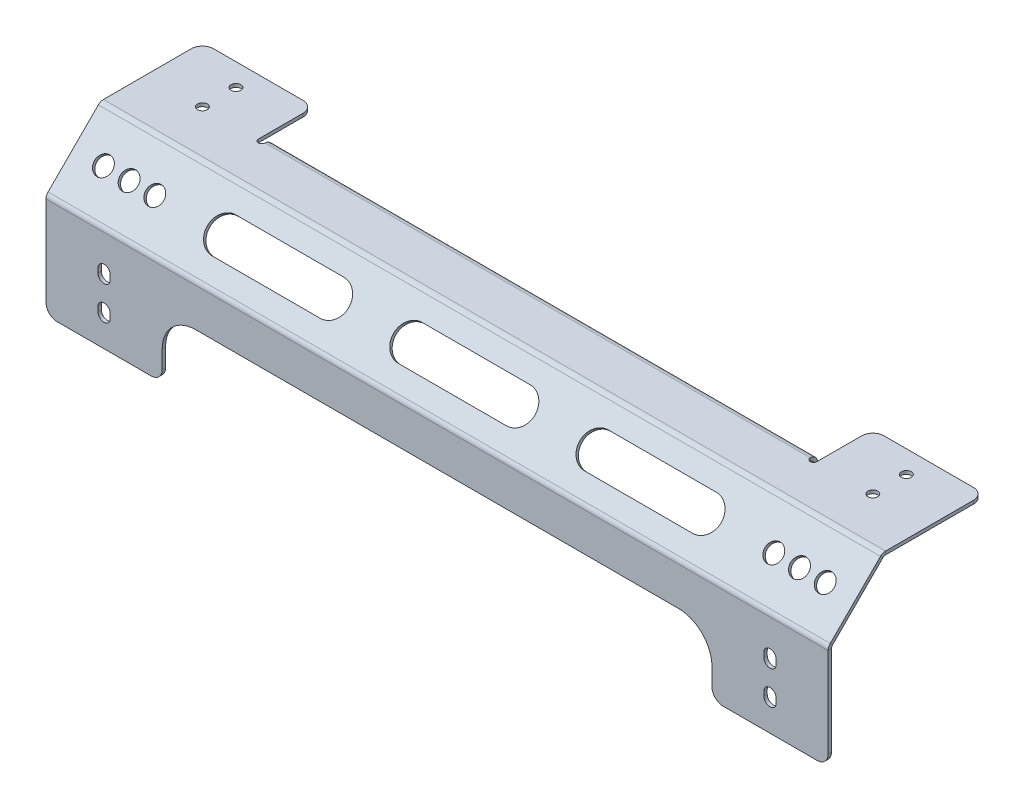
from build123d import *

# Parameters (mm, degrees)
BASE_FLANGE1_DEPTH     = 1.5
EDGE_FLANGE1_DEPTH     = 175
EDGE_FLANGE1_2_DEPTH   = 175
EDGE_FLANGE2_OUTLINE_W = 1.5
EDGE_FLANGE2_OUTLINE_H = 25
EDGE_FLANGE2_DEPTH     = 50
EDGE_FLANGE2_2_DEPTH   = 175
EDGE_FLANGE2_3_DEPTH   = 175
EDGE_FLANGE2_START     = 68
EDGE_FLANGE2_4_DEPTH   = 4
EDGE_FLANGE3_DEPTH     = 122
SKETCH15_R             = 2.2
CUT_EXTRUDE1_DEPTH     = 10
FILLET1_R              = 5
CUT_EXTRUDE2_DEPTH     = 10
CUT_EXTRUDE3_DEPTH     = 10
SKETCH18_R             = 4
CUT_EXTRUDE4_DEPTH     = 10


with BuildPart() as part:
    # Base-Flange1: sheet metal written as solids
    # Sketch1 → Base-Flange1 (new body)
    with BuildSketch(Plane.XY):
        with BuildLine():
            Line((0, 0), (0, 47.9))
            Line((0, 47.9), (175, 47.9))
            Line((175, 47.9), (175, 27.9))
            Line((175, 27.9), (67, 27.9))
            ThreePointArc((67, 27.9), (56.393398282, 23.506601718), (52, 12.9))
            Line((52, 12.9), (52, 0))
            Line((52, 0), (0, 0))
        make_face()
    extrude(amount=-BASE_FLANGE1_DEPTH)

    # Edge-Flange1: read off the stored shape, not the designer's step
    # Edge-Flange1 outline → Edge-Flange1 (cut)
    with BuildSketch(Plane.YZ):
        with BuildLine():
            ThreePointArc((45.0745166, 0), (46.299103584, -0.243585496), (47.3372583, -0.9372583))
            Line((47.3372583, -0.9372583), (47.9, -1.5))
            Line((47.9, -1.5), (47.9, 0))
            Line((47.9, 0), (45.0745166, 0))
        make_face()
    extrude(amount=EDGE_FLANGE1_DEPTH, mode=Mode.SUBTRACT)

    # Edge-Flange1 2 outline → Edge-Flange1 2 (add)
    with BuildSketch(Plane.YZ):
        with BuildLine():
            Line((71.839339828, -25.439339828), (47.9, -1.5))
            Line((47.9, -1.5), (45.0745166, -1.5))
            ThreePointArc((45.0745166, -1.5), (45.725078435, -1.629404795), (46.276598128, -1.997918472))
            Line((46.276598128, -1.997918472), (70.778679656, -26.5))
            Line((70.778679656, -26.5), (71.839339828, -25.439339828))
        make_face()
    extrude(amount=EDGE_FLANGE1_2_DEPTH)

    # Edge-Flange2 2 outline → Edge-Flange2 2 (cut)
    with BuildSketch(Plane.YZ):
        with BuildLine():
            ThreePointArc((69.841421356, -23.441421356), (70.53509416, -24.479576072), (70.778679656, -25.704163056))
            Line((70.778679656, -25.704163056), (70.778679656, -26.5))
            Line((70.778679656, -26.5), (71.839339828, -25.439339828))
            Line((71.839339828, -25.439339828), (69.841421356, -23.441421356))
        make_face()
    extrude(amount=EDGE_FLANGE2_2_DEPTH, mode=Mode.SUBTRACT)



with BuildPart() as body_2:
    # Edge-Flange2: read off the stored shape, not the designer's step
    # Edge-Flange2 outline → Edge-Flange2 (new body)
    with BuildSketch(Plane.YZ):
        with Locations((70.028679656, -57.5)):
            Rectangle(EDGE_FLANGE2_OUTLINE_W, EDGE_FLANGE2_OUTLINE_H)
    extrude(amount=EDGE_FLANGE2_DEPTH)


with BuildPart() as part_1:
    add(part.part)

    add(body_2.part)  # Edge-Flange2 3 merges body 2
    # Edge-Flange2 3 outline → Edge-Flange2 3 (add)
    with BuildSketch(Plane.YZ):
        with BuildLine():
            Line((70.778679656, -45), (70.778679656, -26.5))
            Line((70.778679656, -26.5), (68.780761184, -24.502081528))
            ThreePointArc((68.780761184, -24.502081528), (69.149274862, -25.053601221), (69.278679656, -25.704163056))
            Line((69.278679656, -25.704163056), (69.278679656, -45))
            Line((69.278679656, -45), (70.778679656, -45))
        make_face()
    extrude(amount=EDGE_FLANGE2_3_DEPTH)

    # Edge-Flange2 4 outline → Edge-Flange2 4 (cut)
    with BuildSketch(Plane(origin=(0, 0, 0), x_dir=(1, 0, 0), z_dir=(0, 1, 0)).offset(EDGE_FLANGE2_START)):
        with BuildLine():
            ThreePointArc((50, 45), (51.5, 43.5), (53, 45))
            Line((53, 45), (50, 45))
        make_face()
    extrude(amount=EDGE_FLANGE2_4_DEPTH, mode=Mode.SUBTRACT)

    # Edge-Flange3: sheet metal written as solids
    # Edge-Flange3 section (on a plane across the edge) → Edge-Flange3 (add)
    with BuildSketch(Plane(origin=(53, 69.278679656, -46.7), x_dir=(0, 0, 1), z_dir=(1, 0, 0))):
        with BuildLine():
            Line((-1.5, 1.7), (-1.5, 6.5))
            Line((-1.5, 6.5), (0, 6.5))
            Line((0, 6.5), (0, 1.7))
            ThreePointArc((0, 1.7), (0.497918472, 0.497918472), (1.7, 0))
            Line((1.7, 0), (1.7, -1.5))
            ThreePointArc((1.7, -1.5), (-0.5627417, -0.5627417), (-1.5, 1.7))
        make_face()
    extrude(amount=EDGE_FLANGE3_DEPTH)

    # Sketch15 → Cut-Extrude1 (cut)
    with BuildSketch(Plane(origin=(0, 70.778679656, 0), x_dir=(1, 0, 0), z_dir=(0, 1, 0))):
        with Locations(Location((25, 45, 0), (0, 0, 270))):
            Circle(SKETCH15_R)
        with Locations(Location((25, 60, 0), (0, 0, 270))):
            Circle(SKETCH15_R)
    extrude(amount=-CUT_EXTRUDE1_DEPTH, mode=Mode.SUBTRACT)

    # Fillet1
    fillet1_edges = [part_1.edges().sort_by_distance(p)[0] for p in [
        (52, 0, -0.75),
        (0, 0, -0.75),
        (50, 70.028679656, -70),
        (0, 70.028679656, -70),
        (53, 62.778679656, -47.45),
    ]]
    fillet(fillet1_edges, radius=FILLET1_R)

    # Sketch16 → Cut-Extrude2 (cut)
    with BuildSketch(Plane.XY):
        with BuildLine():
            Line((28.75, 30), (28.75, 28))
            ThreePointArc((28.75, 28), (26, 25.25), (23.25, 28))
            Line((23.25, 28), (23.25, 30))
            ThreePointArc((23.25, 30), (26, 32.75), (28.75, 30))
        make_face()
        with BuildLine():
            Line((28.75, 15), (28.75, 13))
            ThreePointArc((28.75, 13), (26, 10.25), (23.25, 13))
            Line((23.25, 13), (23.25, 15))
            ThreePointArc((23.25, 15), (26, 17.75), (28.75, 15))
        make_face()
    extrude(amount=-CUT_EXTRUDE2_DEPTH, mode=Mode.SUBTRACT)

    # Sketch17 → Cut-Extrude3 (cut)
    with BuildSketch(Plane(origin=(0, 23.2, 23.2), x_dir=(1, 0, 0), z_dir=(0, 0.7071067811865438, 0.7071067811865513))):
        with BuildLine():
            Line((150.833333333, 57.548084348), (199.166666667, 57.548084348))
            ThreePointArc((199.166666667, 57.548084348), (206.666666667, 50.048084348), (199.166666667, 42.548084348))
            Line((199.166666667, 42.548084348), (150.833333333, 42.548084348))
            ThreePointArc((150.833333333, 42.548084348), (143.333333333, 50.048084348), (150.833333333, 57.548084348))
        make_face()
        with BuildLine():
            Line((67.5, 57.548084348), (115.833333333, 57.548084348))
            ThreePointArc((115.833333333, 57.548084348), (123.333333333, 50.048084348), (115.833333333, 42.548084348))
            Line((115.833333333, 42.548084348), (67.5, 42.548084348))
            ThreePointArc((67.5, 42.548084348), (60, 50.048084348), (67.5, 57.548084348))
        make_face()
    extrude(amount=-CUT_EXTRUDE3_DEPTH, mode=Mode.SUBTRACT)

    # Sketch18 → Cut-Extrude4 (cut)
    with BuildSketch(Plane(origin=(0, 23.2, 23.2), x_dir=(1, 0, 0), z_dir=(0, 0.7071067811865438, 0.7071067811865513))):
        with Locations(Location((13.5, 50.048084348, 0), (0, 0, 270))):
            Circle(SKETCH18_R)
        with Locations(Location((36.5, 50.048084348, 0), (0, 0, 270))):
            Circle(SKETCH18_R)
        with Locations(Location((25, 50.048084348, 0), (0, 0, 270))):
            Circle(SKETCH18_R)
    extrude(amount=-CUT_EXTRUDE4_DEPTH, mode=Mode.SUBTRACT)

    # Mirror1: part across plane


with BuildPart() as part_2:
    add(part_1.part)
    add(part_1.part.mirror(Plane(origin=(175, 71.839339828, -25.439339828), x_dir=(0, 0, 1), z_dir=(-1, 0, 0))))


solid = part_2.part
